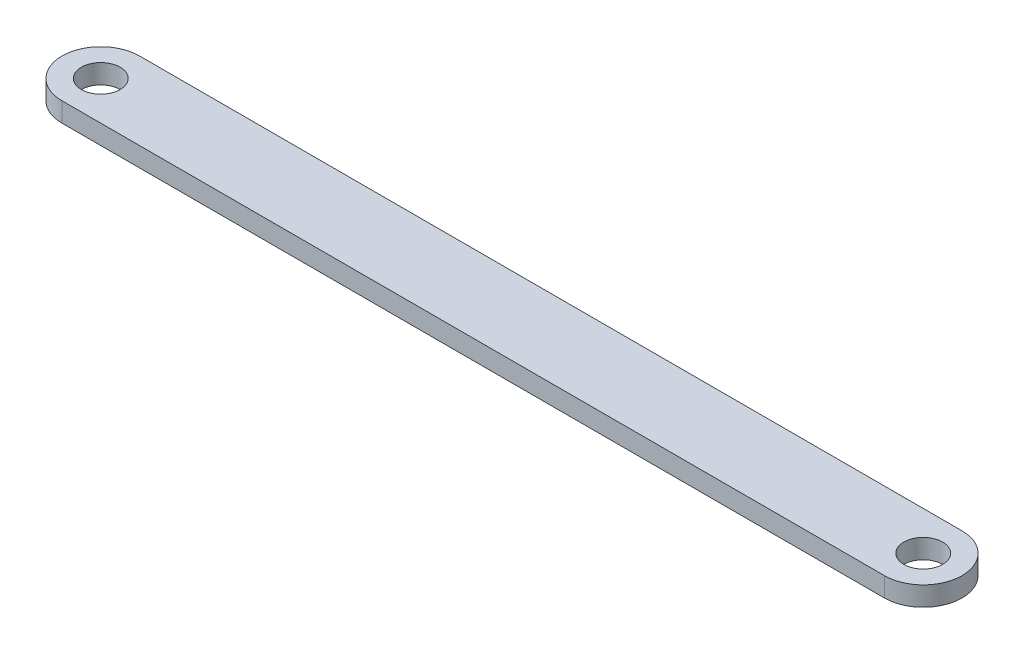
from build123d import *

# Parameters (mm, degrees)
SKETCH1_R           = 5
BOSS_EXTRUDE1_DEPTH = 5


with BuildPart() as part:
    # Sketch1 → Boss-Extrude1 (new body)
    with BuildSketch(Plane(origin=(0, 0, 0), x_dir=(1, 0, 0), z_dir=(0, 1, 0))):
        with BuildLine():
            Line((-106, 10), (106, 10))
            ThreePointArc((106, 10), (116, 0), (106, -10))
            Line((106, -10), (-106, -10))
            ThreePointArc((-106, -10), (-116, 0), (-106, 10))
        make_face()
        with Locations((-106, 0)):
            Circle(SKETCH1_R, mode=Mode.SUBTRACT)
        with Locations((106, 0)):
            Circle(SKETCH1_R, mode=Mode.SUBTRACT)
    extrude(amount=BOSS_EXTRUDE1_DEPTH)


solid = part.part
